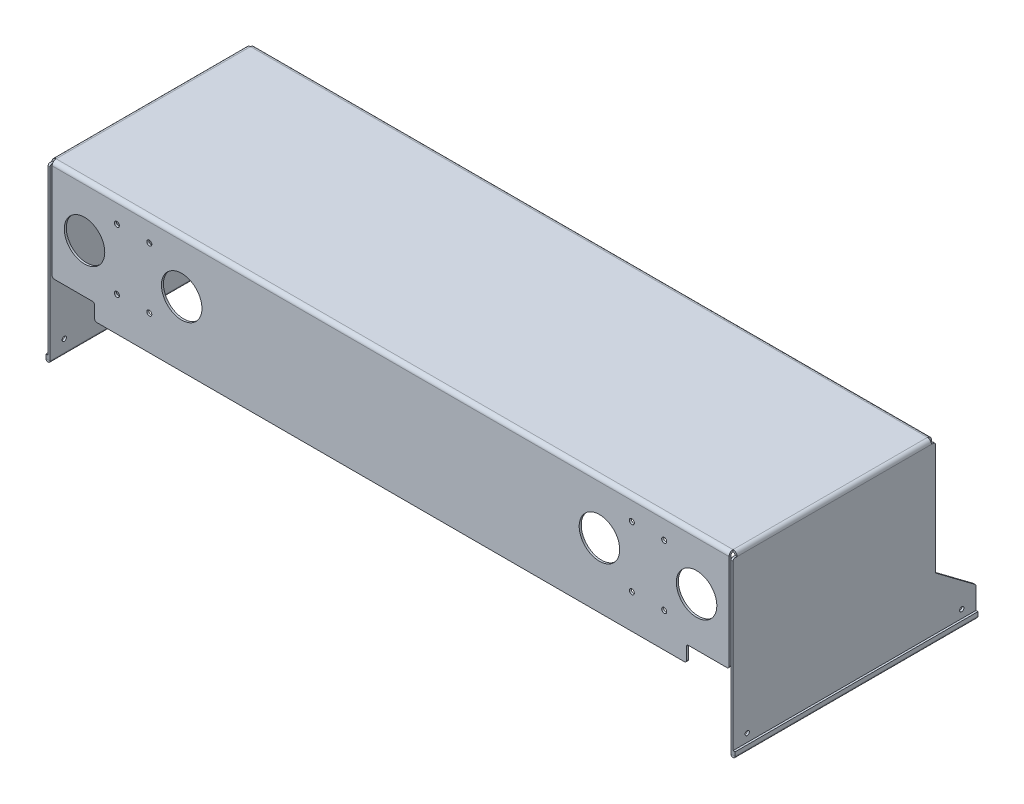
from build123d import *

# Parameters (mm, degrees)
SKETCH1_W                      = 1068.07
SKETCH1_H                      = 317.5
BASE_FLANGE1_DEPTH             = 3.175
EDGE_FLANGE1_STRIP_W           = 19.05
EDGE_FLANGE1_STRIP_H           = 3.175
EDGE_FLANGE1_STRIP_CUT_DEPTH   = 317.5
EDGE_FLANGE1_STRIP_2_W         = 19.05
EDGE_FLANGE1_STRIP_2_H         = 3.175
EDGE_FLANGE1_STRIP_CUT_2_DEPTH = 317.5
EDGE_FLANGE1_DEPTH             = 317.5
EDGE_FLANGE1_BEND_DEPTH        = 317.5
EDGE_FLANGE2_START             = -3.175
EDGE_FLANGE2_DEPTH             = 1074.42
EDGE_FLANGE2_2_DEPTH           = 6.35
EDGE_FLANGE2_START_2           = 1064.895
EDGE_FLANGE2_3_DEPTH           = 6.35
EDGE_FLANGE2_START_3           = 3.175
EDGE_FLANGE2_4_DEPTH           = 1061.72
BOSS_EXTRUDE1_DEPTH            = 3.175
BOSS_EXTRUDE2_DEPTH            = 3.175
SKETCH18_R                     = 3.3734375
CUT_EXTRUDE1_DEPTH             = 1173.961886433
SKETCH19_W                     = 66.675
SKETCH19_H                     = 25.4
CUT_EXTRUDE2_DEPTH             = 1171.054315256
FILLET1_R                      = 3.175
SKETCH20_R                     = 31.75
SKETCH20_R_2                   = 3.96875
CUT_EXTRUDE3_DEPTH             = 19.05
HEM1_START                     = -381
HEM1_DEPTH                     = 381
HEM1_2_DEPTH                   = 381


# Read off the part's stored shape, not the designer's step: Edge-Flange2, Hem1
# Sheet-metal steps are written as plain solids
with BuildPart() as part:
    # Sketch1 → Base-Flange1 (new body)
    with BuildSketch(Plane(origin=(0, 0, 0), x_dir=(1, 0, 0), z_dir=(0, 1, 0))):
        with Locations((534.035, 158.75)):
            Rectangle(SKETCH1_W, SKETCH1_H)
    extrude(amount=-BASE_FLANGE1_DEPTH)

    # Edge-Flange1 strip (across the edge) → Edge-Flange1 strip cut (cut)
    with BuildSketch(Plane(origin=(0, -3.175, 0), x_dir=(1, 0, 0), z_dir=(0, 0, -1))):
        with Locations((-6.35, -1.5875)):
            Rectangle(EDGE_FLANGE1_STRIP_W, EDGE_FLANGE1_STRIP_H)
    extrude(amount=EDGE_FLANGE1_STRIP_CUT_DEPTH, mode=Mode.SUBTRACT)

    # Edge-Flange1 strip 2 (across the edge) → Edge-Flange1 strip cut 2 (cut)
    with BuildSketch(Plane(origin=(1068.07, -3.175, -317.5), x_dir=(-1, 0, 0), z_dir=(0, 0, 1))):
        with Locations((-6.35, -1.5875)):
            Rectangle(EDGE_FLANGE1_STRIP_2_W, EDGE_FLANGE1_STRIP_2_H)
    extrude(amount=EDGE_FLANGE1_STRIP_CUT_2_DEPTH, mode=Mode.SUBTRACT)

    # Edge-Flange1 section (across the edge) → Edge-Flange1 (add)
    with BuildSketch(Plane(origin=(0, -3.175, 0), x_dir=(1, 0, 0), z_dir=(0, 0, -1))):
        with BuildLine():
            Line((-3.175, 3.175), (-3.175, 273.05))
            Line((-3.175, 273.05), (0, 273.05))
            Line((0, 273.05), (0, 3.175))
            ThreePointArc((0, 3.175), (0.92993597, 0.92993597), (3.175, 0))
            Line((3.175, 0), (3.175, -3.175))
            ThreePointArc((3.175, -3.175), (-1.315128061, -1.315128061), (-3.175, 3.175))
        make_face()
    extrude(amount=EDGE_FLANGE1_DEPTH)

    # Edge-Flange1 section 2 (across the edge) → Edge-Flange1 bend (add)
    with BuildSketch(Plane(origin=(1068.07, -3.175, -317.5), x_dir=(-1, 0, 0), z_dir=(0, 0, 1))):
        with BuildLine():
            Line((-3.175, 3.175), (-3.175, 273.05))
            Line((-3.175, 273.05), (0, 273.05))
            Line((0, 273.05), (0, 3.175))
            ThreePointArc((0, 3.175), (0.92993597, 0.92993597), (3.175, 0))
            Line((3.175, 0), (3.175, -3.175))
            ThreePointArc((3.175, -3.175), (-1.315128061, -1.315128061), (-3.175, 3.175))
        make_face()
    extrude(amount=EDGE_FLANGE1_BEND_DEPTH)

    # Edge-Flange2 outline → Edge-Flange2 (cut)
    with BuildSketch(Plane.YZ.offset(EDGE_FLANGE2_START)):
        with BuildLine():
            Line((-3.175, -311.15), (-6.35, -311.15))
            Line((-6.35, -311.15), (-6.35, -314.325))
            ThreePointArc((-6.35, -314.325), (-4.10493597, -313.39506403), (-3.175, -311.15))
        make_face()
        with BuildLine():
            Line((-6.35, -317.5), (0, -317.5))
            Line((0, -317.5), (0, -311.15))
            ThreePointArc((0, -311.15), (-1.859871939, -315.640128061), (-6.35, -317.5))
        make_face()
        with BuildLine():
            Line((-6.35, -6.35), (-3.175, -6.35))
            ThreePointArc((-3.175, -6.35), (-4.10493597, -4.10493597), (-6.35, -3.175))
            Line((-6.35, -3.175), (-6.35, -6.35))
        make_face()
        with BuildLine():
            Line((0, -6.35), (0, 0))
            Line((0, 0), (-6.35, 0))
            ThreePointArc((-6.35, 0), (-1.859871939, -1.859871939), (0, -6.35))
        make_face()
    extrude(amount=EDGE_FLANGE2_DEPTH, mode=Mode.SUBTRACT)

    # Edge-Flange2 2 outline → Edge-Flange2 2 (cut)
    with BuildSketch(Plane.YZ.offset(EDGE_FLANGE2_START)):
        with BuildLine():
            ThreePointArc((-3.175, -311.15), (-4.10493597, -313.39506403), (-6.35, -314.325))
            Line((-6.35, -314.325), (-6.35, -317.5))
            ThreePointArc((-6.35, -317.5), (-1.859871939, -315.640128061), (0, -311.15))
            Line((0, -311.15), (-3.175, -311.15))
        make_face()
        with BuildLine():
            ThreePointArc((0, -6.35), (-1.859871939, -1.859871939), (-6.35, 0))
            Line((-6.35, 0), (-6.35, -3.175))
            ThreePointArc((-6.35, -3.175), (-4.10493597, -4.10493597), (-3.175, -6.35))
            Line((-3.175, -6.35), (0, -6.35))
        make_face()
    extrude(amount=EDGE_FLANGE2_2_DEPTH, mode=Mode.SUBTRACT)

    # Edge-Flange2 3 outline → Edge-Flange2 3 (cut)
    with BuildSketch(Plane.YZ.offset(EDGE_FLANGE2_START_2)):
        with BuildLine():
            ThreePointArc((-3.175, -311.15), (-4.10493597, -313.39506403), (-6.35, -314.325))
            Line((-6.35, -314.325), (-6.35, -317.5))
            ThreePointArc((-6.35, -317.5), (-1.859871939, -315.640128061), (0, -311.15))
            Line((0, -311.15), (-3.175, -311.15))
        make_face()
        with BuildLine():
            ThreePointArc((0, -6.35), (-1.859871939, -1.859871939), (-6.35, 0))
            Line((-6.35, 0), (-6.35, -3.175))
            ThreePointArc((-6.35, -3.175), (-4.10493597, -4.10493597), (-3.175, -6.35))
            Line((-3.175, -6.35), (0, -6.35))
        make_face()
    extrude(amount=EDGE_FLANGE2_3_DEPTH, mode=Mode.SUBTRACT)

    # Edge-Flange2 4 outline → Edge-Flange2 4 (add)
    with BuildSketch(Plane.YZ.offset(EDGE_FLANGE2_START_3)):
        with BuildLine():
            ThreePointArc((-3.175, -311.15), (-4.10493597, -313.39506403), (-6.35, -314.325))
            Line((-6.35, -314.325), (-184.15, -314.325))
            Line((-184.15, -314.325), (-184.15, -317.5))
            Line((-184.15, -317.5), (-6.35, -317.5))
            ThreePointArc((-6.35, -317.5), (-4.706499064, -317.283628997), (-3.175, -316.649261315))
            Line((-3.175, -316.649261315), (-3.175, -311.15))
        make_face()
        with BuildLine():
            ThreePointArc((-6.35, -3.175), (-4.10493597, -4.10493597), (-3.175, -6.35))
            Line((-3.175, -6.35), (-3.175, -0.850738685))
            ThreePointArc((-3.175, -0.850738685), (-4.706499064, -0.216371003), (-6.35, 0))
            Line((-6.35, 0), (-184.15, 0))
            Line((-184.15, 0), (-184.15, -3.175))
            Line((-184.15, -3.175), (-6.35, -3.175))
        make_face()
    extrude(amount=EDGE_FLANGE2_4_DEPTH)

    # Sketch16 → Boss-Extrude1 (add)
    with BuildSketch(Plane(origin=(1071.245, 0, 0), x_dir=(0, 0, -1), z_dir=(1, 0, 0))):
        Polygon((317.5, -276.225), (381, -276.225), (381, -231.775), (317.5, -184.15), align=None)
    extrude(amount=-BOSS_EXTRUDE1_DEPTH)

    # Sketch17 → Boss-Extrude2 (add)
    with BuildSketch(Plane.ZY.offset(3.175)):
        Polygon((-317.5, -276.225), (-317.5, -184.15), (-381, -231.775), (-381, -276.225), align=None)
    extrude(amount=-BOSS_EXTRUDE2_DEPTH)

    # Sketch18 → Cut-Extrude1 (cut, through all)
    with BuildSketch(Plane.ZY.offset(3.175)):
        with Locations(Location((-358.775, -254, 0), (0, 0, 270))):
            Circle(SKETCH18_R)
        with Locations(Location((-22.225, -254, 0), (0, 0, 270))):
            Circle(SKETCH18_R)
    extrude(amount=-CUT_EXTRUDE1_DEPTH, mode=Mode.SUBTRACT)

    # Sketch19 → Cut-Extrude2 (cut, through all)
    with BuildSketch(Plane.XY):
        with Locations((36.5125, -171.45)):
            Rectangle(SKETCH19_W, SKETCH19_H)
        with Locations((1031.5575, -171.45)):
            Rectangle(SKETCH19_W, SKETCH19_H)
    extrude(amount=-CUT_EXTRUDE2_DEPTH, mode=Mode.SUBTRACT)

    # Fillet1
    fillet1_edges = [part.edges().sort_by_distance(p)[0] for p in [
        (1064.895, -158.75, -315.9125),
        (998.22, -158.75, -315.9125),
        (998.22, -184.15, -315.9125),
        (1064.895, -158.75, -1.5875),
        (998.22, -158.75, -1.5875),
        (998.22, -184.15, -1.5875),
        (3.175, -158.75, -315.9125),
        (69.85, -184.15, -315.9125),
        (69.85, -158.75, -315.9125),
        (69.85, -184.15, -1.5875),
        (69.85, -158.75, -1.5875),
        (3.175, -158.75, -1.5875),
        (1069.6575, -231.775, -381),
        (1069.6575, -184.15, -317.5),
        (1069.6575, -6.35, -317.5),
        (1069.6575, -6.35, 0),
        (-1.5875, -6.35, 0),
        (-1.5875, -6.35, -317.5),
        (-1.5875, -184.15, -317.5),
        (-1.5875, -231.775, -381),
    ]]
    fillet(fillet1_edges, radius=FILLET1_R)

    # Sketch20 → Cut-Extrude3 (cut)
    with BuildSketch(Plane.XY):
        with Locations((53.975, -82.55)):
            Circle(SKETCH20_R)
        with Locations((206.375, -82.55)):
            Circle(SKETCH20_R)
        with Locations((861.695, -82.55)):
            Circle(SKETCH20_R)
        with Locations((1014.095, -82.55)):
            Circle(SKETCH20_R)
        with Locations((104.775, -130.175)):
            Circle(SKETCH20_R_2)
        with Locations((104.775, -34.925)):
            Circle(SKETCH20_R_2)
        with Locations((155.575, -34.925)):
            Circle(SKETCH20_R_2)
        with Locations((155.575, -130.175)):
            Circle(SKETCH20_R_2)
        with Locations((963.295, -130.175)):
            Circle(SKETCH20_R_2)
        with Locations((912.495, -130.175)):
            Circle(SKETCH20_R_2)
        with Locations((912.495, -34.925)):
            Circle(SKETCH20_R_2)
        with Locations((963.295, -34.925)):
            Circle(SKETCH20_R_2)
    extrude(amount=-CUT_EXTRUDE3_DEPTH, mode=Mode.SUBTRACT)

    # Hem1 outline → Hem1 (cut)
    with BuildSketch(Plane.XY.offset(HEM1_START)):
        with BuildLine():
            ThreePointArc((0, -273), (-0.926970953, -275.262672645), (-3.175, -276.22461238))
            Line((-3.175, -276.22461238), (-3.175, -276.225))
            Line((-3.175, -276.225), (0, -276.225))
            Line((0, -276.225), (0, -273))
        make_face()
        with BuildLine():
            Line((1071.245, -276.225), (1071.245, -276.22461238))
            ThreePointArc((1071.245, -276.22461238), (1068.996970953, -275.262672645), (1068.07, -273))
            Line((1068.07, -273), (1068.07, -276.225))
            Line((1068.07, -276.225), (1071.245, -276.225))
        make_face()
    extrude(amount=HEM1_DEPTH, mode=Mode.SUBTRACT)

    # Hem1 2 outline → Hem1 2 (add)
    with BuildSketch(Plane.XY.offset(HEM1_START)):
        with BuildLine():
            Line((-3.275, -266.7), (-6.45, -266.7))
            Line((-6.45, -266.7), (-6.45, -273))
            ThreePointArc((-6.45, -273), (-5.487672645, -275.298029047), (-3.175, -276.22461238))
            Line((-3.175, -276.22461238), (-3.175, -273))
            ThreePointArc((-3.175, -273), (-3.225, -273.05), (-3.275, -273))
            Line((-3.275, -273), (-3.275, -266.7))
        make_face()
        with BuildLine():
            Line((1074.52, -266.7), (1071.345, -266.7))
            Line((1071.345, -266.7), (1071.345, -273))
            ThreePointArc((1071.345, -273), (1071.295, -273.05), (1071.245, -273))
            Line((1071.245, -273), (1071.245, -276.22461238))
            ThreePointArc((1071.245, -276.22461238), (1073.557672645, -275.298029047), (1074.52, -273))
            Line((1074.52, -273), (1074.52, -266.7))
        make_face()
    extrude(amount=HEM1_2_DEPTH)


solid = part.part
